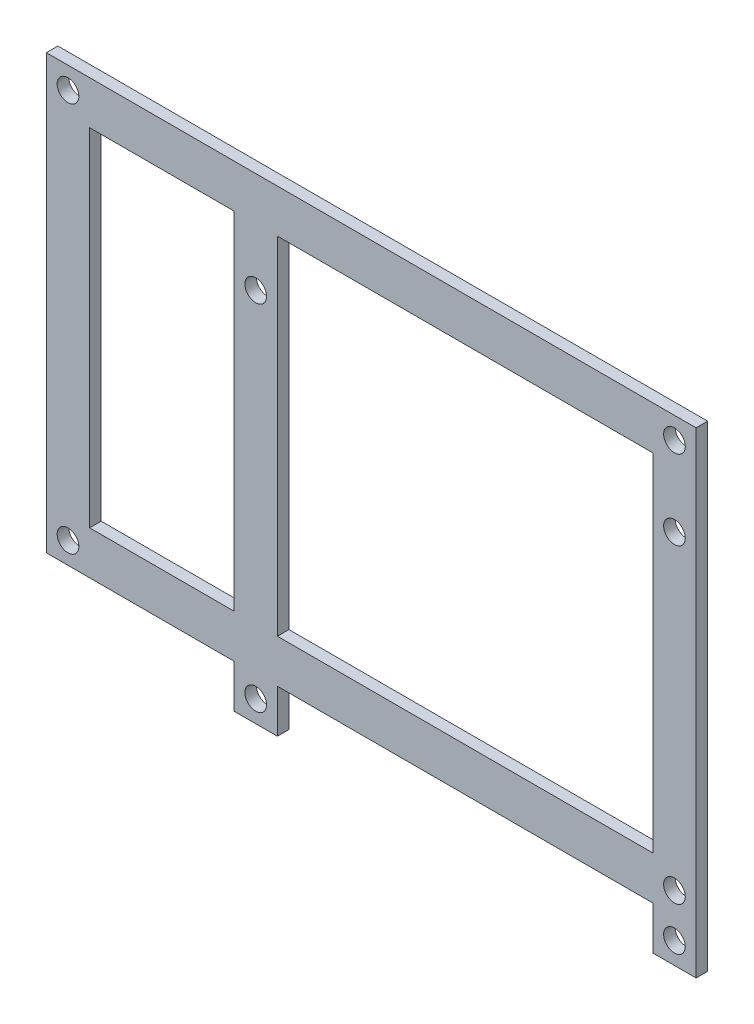
from build123d import *

# Parameters (mm, degrees)
PLATES_BASE_OUTLINE_W   = 90
PLATES_BASE_OUTLINE_H   = 60
PLATES_BASE_OUTLINE_R   = 1.5
PLATES_BASE_OUTLINE_W_2 = 76
PLATES_BASE_OUTLINE_H_2 = 20
PLATES_BASE_DEPTH       = 1.6
SKETCH_4_W              = 78
SKETCH_4_H              = 48
CUT_EXTRUDE_1_DEPTH     = 94.689835584
SKETCH_7_W              = 6
SKETCH_7_H              = 6
EXTRUDE_4_DEPTH         = 1.6
SKETCH_8_W              = 6
SKETCH_8_H              = 48
EXTRUDE_5_DEPTH         = 1.6
SKETCH_10_R             = 1.5
CUT_EXTRUDE_4_DEPTH     = 1.6


# Read off the part's stored shape, not the designer's step: plates=base
with BuildPart() as part:
    # plates=base outline → plates=base (new body)
    with BuildSketch(Plane.XY):
        with Locations((-41.587399894, 5.746992481)):
            Rectangle(PLATES_BASE_OUTLINE_W, PLATES_BASE_OUTLINE_H)
        with Locations((-83.587399894, -21.253007519)):
            Circle(PLATES_BASE_OUTLINE_R, mode=Mode.SUBTRACT)
        with Locations((0.412600106, -21.253007519)):
            Circle(PLATES_BASE_OUTLINE_R, mode=Mode.SUBTRACT)
        with Locations((-41.587399894, -7.253007519)):
            Rectangle(PLATES_BASE_OUTLINE_W_2, PLATES_BASE_OUTLINE_H_2, mode=Mode.SUBTRACT)
        with Locations((-78.587399894, 5.746992481)):
            Circle(PLATES_BASE_OUTLINE_R, mode=Mode.SUBTRACT)
        with Locations((-83.587399894, 32.746992481)):
            Circle(PLATES_BASE_OUTLINE_R, mode=Mode.SUBTRACT)
        with Locations((-41.587399894, 18.746992481)):
            Rectangle(PLATES_BASE_OUTLINE_W_2, PLATES_BASE_OUTLINE_H_2, mode=Mode.SUBTRACT)
        with Locations((-4.587399894, 5.746992481)):
            Circle(PLATES_BASE_OUTLINE_R, mode=Mode.SUBTRACT)
        with Locations((0.412600106, 32.746992481)):
            Circle(PLATES_BASE_OUTLINE_R, mode=Mode.SUBTRACT)
    extrude(amount=PLATES_BASE_DEPTH)

    # ｽｹｯﾁ4 → ｶｯﾄ - 押し出し1 (cut, through all)
    with BuildSketch(Plane.XY.offset(1.6)):
        with Locations((-41.587399894, 5.746992481)):
            Rectangle(SKETCH_4_W, SKETCH_4_H)
    extrude(amount=-CUT_EXTRUDE_1_DEPTH, mode=Mode.SUBTRACT)

    # ｽｹｯﾁ7 → ﾎﾞｽ - 押し出し4 (add)
    with BuildSketch(Plane.XY.offset(1.6)):
        with Locations((0.412600106, -27.253007519)):
            Rectangle(SKETCH_7_W, SKETCH_7_H)
        with Locations((-57.587399894, -27.253007519)):
            Rectangle(SKETCH_7_W, SKETCH_7_H)
    extrude(amount=-EXTRUDE_4_DEPTH)

    # ｽｹｯﾁ8 → ﾎﾞｽ - 押し出し5 (add)
    with BuildSketch(Plane.XY.offset(1.6)):
        with Locations((-57.587399894, 5.746992481)):
            Rectangle(SKETCH_8_W, SKETCH_8_H)
    extrude(amount=-EXTRUDE_5_DEPTH)

    # ｽｹｯﾁ10 → ｶｯﾄ - 押し出し4 (cut)
    with BuildSketch(Plane.XY.offset(1.6)):
        with Locations((0.412600106, -27.253007519)):
            Circle(SKETCH_10_R)
        with Locations((-57.587399894, -27.253007519)):
            Circle(SKETCH_10_R)
        with Locations((-57.587399894, 21.746992481)):
            Circle(SKETCH_10_R)
        with Locations((0.412600106, 21.746992481)):
            Circle(SKETCH_10_R)
    extrude(amount=-CUT_EXTRUDE_4_DEPTH, mode=Mode.SUBTRACT)


solid = part.part
